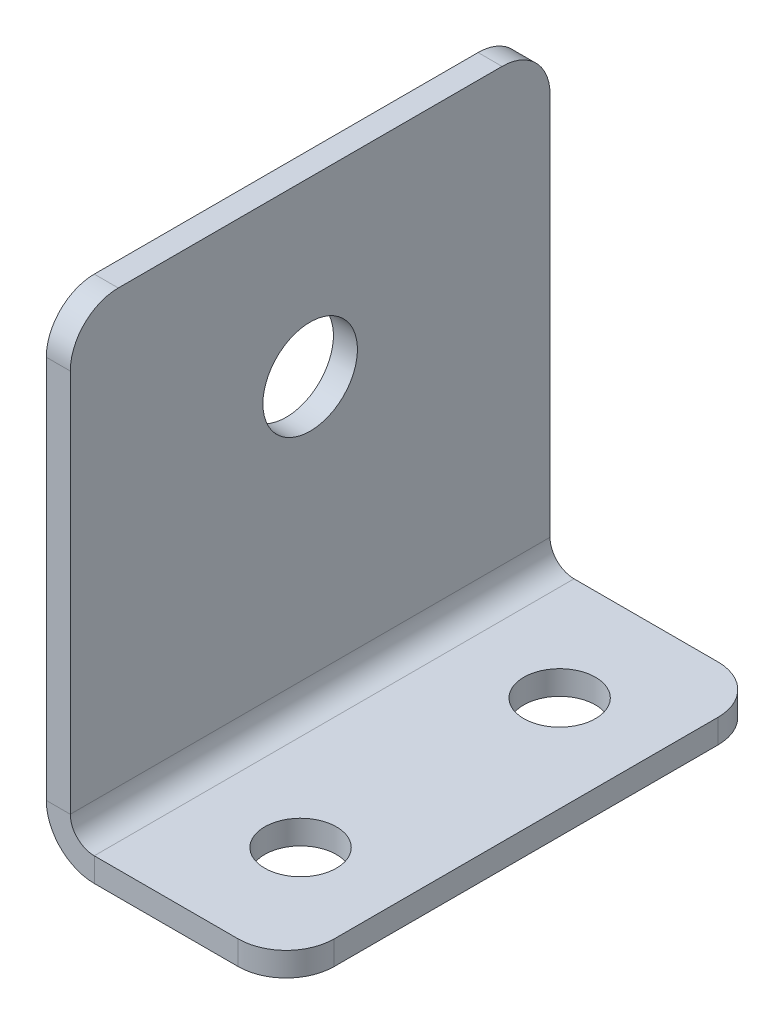
from build123d import *

# Parameters (mm, degrees)
BOSS_EXTRUDE1_DEPTH    = 25.4
CONVERT_SOLID1_DEPTH   = 25.4
CONVERT_SOLID1_2_DEPTH = 25.4
SKETCH7_R              = 2.5019
CUT_EXTRUDE1_DEPTH     = 39.1
FILLET1_R              = 2.54
SKETCH8_R              = 1.89865
CUT_EXTRUDE2_DEPTH     = 38.265357908


# Read off the part's stored shape, not the designer's step: Convert-Solid1
with BuildPart() as part:
    # Sketch2 → Boss-Extrude1 (new body)
    with BuildSketch(Plane.XY):
        Polygon((0, 0), (0, 25.4), (1.27, 25.4), (1.27, 1.27), (12.7, 1.27), (12.7, 0), align=None)
    extrude(amount=BOSS_EXTRUDE1_DEPTH)

    # Convert-Solid1 outline → Convert-Solid1 (cut)
    with BuildSketch(Plane.XY):
        with BuildLine():
            ThreePointArc((2.54, 0), (0.743948776, 0.743948776), (0, 2.54))
            Line((0, 2.54), (0, 0))
            Line((0, 0), (2.54, 0))
        make_face()
    extrude(amount=CONVERT_SOLID1_DEPTH, mode=Mode.SUBTRACT)

    # Convert-Solid1 2 outline → Convert-Solid1 2 (add)
    with BuildSketch(Plane.XY):
        with BuildLine():
            ThreePointArc((2.54, 1.27), (1.641974388, 1.641974388), (1.27, 2.54))
            Line((1.27, 2.54), (1.27, 1.27))
            Line((1.27, 1.27), (2.54, 1.27))
        make_face()
    extrude(amount=CONVERT_SOLID1_2_DEPTH)

    # Sketch7 → Cut-Extrude1 (cut, through all)
    with BuildSketch(Plane.ZY):
        with Locations((12.7, 16.256)):
            Circle(SKETCH7_R)
    extrude(amount=-CUT_EXTRUDE1_DEPTH, mode=Mode.SUBTRACT)

    # Fillet1
    fillet1_edges = [part.edges().sort_by_distance(p)[0] for p in [
        (12.7, 0.635, 0),
        (12.7, 0.635, 25.4),
        (0.635, 25.4, 25.4),
        (0.635, 25.4, 0),
    ]]
    fillet(fillet1_edges, radius=FILLET1_R)

    # Sketch8 → Cut-Extrude2 (cut, through all)
    with BuildSketch(Plane(origin=(0, 1.27, 0), x_dir=(1, 0, 0), z_dir=(0, 1, 0))):
        with Locations(Location((7.62, -5.842, 0), (0, 0, 270))):
            Circle(SKETCH8_R)
        with Locations(Location((7.62, -19.558, 0), (0, 0, 270))):
            Circle(SKETCH8_R)
    extrude(amount=-CUT_EXTRUDE2_DEPTH, mode=Mode.SUBTRACT)


solid = part.part
